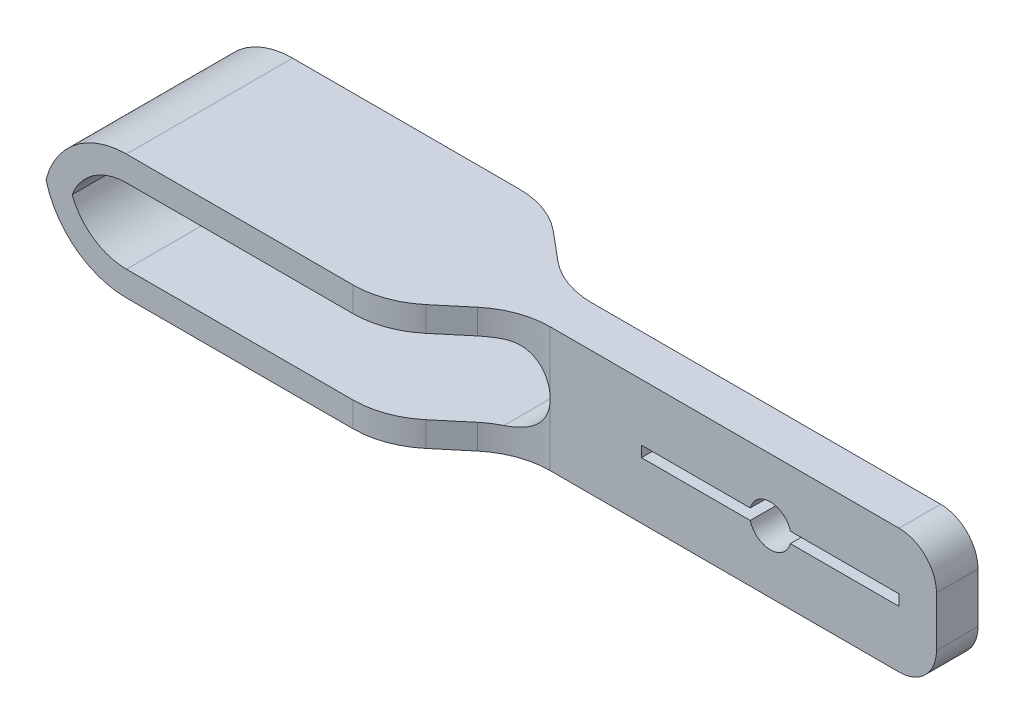
from build123d import *

# Parameters (mm, degrees)
ESBO_O1_W                         = 40
ESBO_O1_H                         = 15
RESSALTO_EXTRUS_O1_DEPTH          = 3
ESBO_O3_W                         = 40
ESBO_O3_H                         = 15
RESSALTO_EXTRUS_O2_DEPTH          = 2
CORTE_EXTRUS_O1_REACH             = 26.418
CORTE_EXTRUS_O1_DIRECTION_2_REACH = 26.418
ESBO_O5_W                         = 20
ESBO_O5_H                         = 15
RESSALTO_EXTRUS_O4_DEPTH          = 60
CHANFRO1_SIZE                     = 19.068057482
CHANFRO1_SIZE_2                   = 16
FILETE4_R                         = 10
CORTE_EXTRUS_O2_DEPTH             = 81.237970309
FILETE5_R                         = 4.5


with BuildPart() as part:
    # Esboço1 → Ressalto-extrusão1 (new body)
    with BuildSketch(Plane.XY):
        with Locations((2.5, 1.5)):
            Rectangle(ESBO_O1_W, ESBO_O1_H)
    extrude(amount=-RESSALTO_EXTRUS_O1_DEPTH)

    # Esboço3 → Ressalto-extrusão2 (add)
    with BuildSketch(Plane.XY):
        with Locations((2.5, 1.5)):
            Rectangle(ESBO_O3_W, ESBO_O3_H)
    extrude(amount=RESSALTO_EXTRUS_O2_DEPTH)

    # Corte-extrusão1: up to this face of the body (flat: up to its plane)
    corte_extrus_o1_end = Plane(part.part.faces().sort_by_distance((2.5, 1.5, 2))[0])
    # Esboço2 → Corte-extrusão1 (cut, up to the picked face)
    with BuildSketch(Plane.XY, mode=Mode.PRIVATE) as corte_extrus_o1_sk1:
        with BuildLine():
            Line((0.085978459, 2.15), (-13, 2.15))
            Line((-13, 2.15), (-13, 0.85))
            Line((-13, 0.85), (0.085978459, 0.85))
            ThreePointArc((0.085978459, 0.85), (2.5, -1), (4.914021541, 0.85))
            Line((4.914021541, 0.85), (18, 0.85))
            Line((18, 0.85), (18, 2.15))
            Line((18, 2.15), (4.914021541, 2.15))
            ThreePointArc((4.914021541, 2.15), (2.5, 4), (0.085978459, 2.15))
        make_face()
    corte_extrus_o1_tool1 = split(extrude(corte_extrus_o1_sk1.sketch, amount=CORTE_EXTRUS_O1_REACH, mode=Mode.PRIVATE), bisect_by=corte_extrus_o1_end, keep=Keep.BOTH, mode=Mode.PRIVATE)
    add(corte_extrus_o1_tool1.solids().sort_by(Axis((2.5, 1.5, 0), (0, 0, 1)))[0], mode=Mode.SUBTRACT)

    # Corte-extrusão1 direction 2: up to this face of the body (flat: up to its plane)
    corte_extrus_o1_direction_2_end = Plane(part.part.faces().sort_by_distance((2.5, 1.5, -3))[0])
    # Esboço2 → Corte-extrusão1 direction 2 (cut, up to the picked face)
    with BuildSketch(Plane.XY, mode=Mode.PRIVATE) as corte_extrus_o1_direction_2_sk1:
        with BuildLine():
            Line((0.085978459, 2.15), (-13, 2.15))
            Line((-13, 2.15), (-13, 0.85))
            Line((-13, 0.85), (0.085978459, 0.85))
            ThreePointArc((0.085978459, 0.85), (2.5, -1), (4.914021541, 0.85))
            Line((4.914021541, 0.85), (18, 0.85))
            Line((18, 0.85), (18, 2.15))
            Line((18, 2.15), (4.914021541, 2.15))
            ThreePointArc((4.914021541, 2.15), (2.5, 4), (0.085978459, 2.15))
        make_face()
    corte_extrus_o1_direction_2_tool1 = split(extrude(corte_extrus_o1_direction_2_sk1.sketch, amount=-CORTE_EXTRUS_O1_DIRECTION_2_REACH, mode=Mode.PRIVATE), bisect_by=corte_extrus_o1_direction_2_end, keep=Keep.BOTH, mode=Mode.PRIVATE)
    add(corte_extrus_o1_direction_2_tool1.solids().sort_by(Axis((2.5, 1.5, 0), (0, 0, -1)))[0], mode=Mode.SUBTRACT)

    # Esboço5 → Ressalto-extrusão4 (add)
    with BuildSketch(Plane.ZY.offset(17.5)):
        with Locations((-0.5, 1.5)):
            Rectangle(ESBO_O5_W, ESBO_O5_H)
    extrude(amount=RESSALTO_EXTRUS_O4_DEPTH)

    # Chanfro1
    # the kernel refuses this chamfer: 19.068057482, 16 mm, written as the material it takes off along each edge
    with BuildSketch(Plane(origin=(-17.5, -55.146127732, 9.5), x_dir=(-0.9996889667359941, 0, 0.024939322090234247), z_dir=(0, 1, 0))) as chanfro1_piece_1_section:
        Polygon((CHANFRO1_SIZE * 0.99968896671, -CHANFRO1_SIZE * 0.0249393220896), (-CHANFRO1_SIZE_2 * 0.0249393220902, -CHANFRO1_SIZE_2 * 0.999688966736), (0, 0), align=None)
    chanfro1_piece_1 = extrude(amount=113.292255464, mode=Mode.PRIVATE)
    chanfro1_piece_1 = split(chanfro1_piece_1, bisect_by=Plane(origin=(-25.155035178, 1.5, 2), z_dir=(0, 0, 1)), keep=Keep.TOP, mode=Mode.PRIVATE)
    add(chanfro1_piece_1, mode=Mode.SUBTRACT)
    with BuildSketch(Plane(origin=(-17.5, -55.146127732, 9.5), x_dir=(-0.9996889667359941, 0, 0.024939322090234247), z_dir=(0, 1, 0))) as chanfro1_piece_2_section:
        Polygon((CHANFRO1_SIZE * 0.99968896671, -CHANFRO1_SIZE * 0.0249393220896), (-CHANFRO1_SIZE_2 * 0.0249393220902, -CHANFRO1_SIZE_2 * 0.999688966736), (0, 0), align=None)
    chanfro1_piece_2 = extrude(amount=113.292255464, mode=Mode.PRIVATE)
    chanfro1_piece_2 = split(chanfro1_piece_2, bisect_by=Plane(origin=(-18.373305927, 1.5, -3), z_dir=(0, 0, -1)), keep=Keep.TOP, mode=Mode.PRIVATE)
    add(chanfro1_piece_2, mode=Mode.SUBTRACT)
    with BuildSketch(Plane(origin=(-17.5, 58.146127732, -10.5), x_dir=(-0.9996889667359941, 0, -0.024939322090234247), z_dir=(0, -1, 0))) as chanfro1_piece_3_section:
        Polygon((CHANFRO1_SIZE * 0.99968896671, -CHANFRO1_SIZE * 0.0249393220896), (-CHANFRO1_SIZE_2 * 0.0249393220902, -CHANFRO1_SIZE_2 * 0.999688966736), (0, 0), align=None)
    chanfro1_piece_3 = extrude(amount=113.292255464, mode=Mode.PRIVATE)
    chanfro1_piece_3 = split(chanfro1_piece_3, bisect_by=Plane(origin=(-25.155035178, 1.5, -3), z_dir=(0, 0, -1)), keep=Keep.TOP, mode=Mode.PRIVATE)
    add(chanfro1_piece_3, mode=Mode.SUBTRACT)
    with BuildSketch(Plane(origin=(-17.5, 58.146127732, -10.5), x_dir=(-0.9996889667359941, 0, -0.024939322090234247), z_dir=(0, -1, 0))) as chanfro1_piece_4_section:
        Polygon((CHANFRO1_SIZE * 0.99968896671, -CHANFRO1_SIZE * 0.0249393220896), (-CHANFRO1_SIZE_2 * 0.0249393220902, -CHANFRO1_SIZE_2 * 0.999688966736), (0, 0), align=None)
    chanfro1_piece_4 = extrude(amount=113.292255464, mode=Mode.PRIVATE)
    chanfro1_piece_4 = split(chanfro1_piece_4, bisect_by=Plane(origin=(-18.373305927, 1.5, 2), z_dir=(0, 0, 1)), keep=Keep.TOP, mode=Mode.PRIVATE)
    add(chanfro1_piece_4, mode=Mode.SUBTRACT)

    # Filete4
    # the kernel refuses this fillet: 10 mm, written as the material it adds along each edge
    with BuildSketch(Plane(origin=(-27.629905537, -6, 2), x_dir=(1, 0, 0), z_dir=(0, 1, 0)), Plane(origin=(-27.629905537, 9, -3), x_dir=(1, 0, 0), z_dir=(0, -1, 0))) as filete4_piece_1:
        with BuildLine():
            CenterArc((FILETE4_R * 0.363970234266, -FILETE4_R), FILETE4_R, 90, 40)
            Line((-FILETE4_R * 0.27881737542, -FILETE4_R * 0.233955556881), (0, 0))
            Line((0, 0), (FILETE4_R * 0.363970234266, 0))
        make_face()
    extrude(amount=15)
    # the kernel refuses this fillet: 10 mm, written as the material it takes off along each edge
    with BuildSketch(Plane(origin=(-36.568057482, -15.099255857, 9.5), x_dir=(-1, 0, 0), z_dir=(0, 1, 0))) as filete4_2_piece_1:
        with BuildLine():
            CenterArc((FILETE4_R * 0.363970234266, -FILETE4_R), FILETE4_R, 90, 40)
            Line((-FILETE4_R * 0.27881737542, -FILETE4_R * 0.233955556881), (0, 0))
            Line((0, 0), (FILETE4_R * 0.363970234266, 0))
        make_face()
    extrude(amount=33.198511713, mode=Mode.SUBTRACT)
    with BuildSketch(Plane(origin=(-77.5, 9, 34.5), x_dir=(0, -1, 0), z_dir=(0, 0, -1))) as filete4_2_piece_2:
        with BuildLine():
            CenterArc((FILETE4_R, -FILETE4_R), FILETE4_R, 90, 90)
            Line((0, -FILETE4_R), (0, 0))
            Line((0, 0), (FILETE4_R, 0))
        make_face()
    extrude(amount=70, mode=Mode.SUBTRACT)
    with BuildSketch(Plane(origin=(-77.5, -6, -35.5), x_dir=(1, 0, 0), z_dir=(0, 0, 1))) as filete4_2_piece_3:
        with BuildLine():
            CenterArc((FILETE4_R, FILETE4_R), FILETE4_R, 180, 90)
            Line((0, FILETE4_R), (0, 0))
            Line((0, 0), (FILETE4_R, 0))
        make_face()
    extrude(amount=70, mode=Mode.SUBTRACT)
    with BuildSketch(Plane(origin=(-36.568057482, 18.099255857, -10.5), x_dir=(0.7660444431190706, 0, 0.6427876096864291), z_dir=(0, -1, 0))) as filete4_2_piece_4:
        with BuildLine():
            CenterArc((FILETE4_R * 0.363970234266, FILETE4_R), FILETE4_R, 230, 40)
            Line((-FILETE4_R * 0.27881737542, FILETE4_R * 0.233955556881), (0, 0))
            Line((0, 0), (FILETE4_R * 0.363970234266, 0))
        make_face()
    extrude(amount=33.198511713, mode=Mode.SUBTRACT)

    # Esboço6 → Corte-extrusão2 (cut, through all)
    with BuildSketch(Plane.XY.offset(9.5)):
        with BuildLine():
            Line((-43.207759824, 6), (-67.5, 6))
            ThreePointArc((-67.5, 6), (-71.468626967, 4.766281297), (-74.038348415, 1.5))
            ThreePointArc((-74.038348415, 1.5), (-71.468626967, -1.766281297), (-67.5, -3))
            Line((-67.5, -3), (-43.207759824, -3))
            Line((-43.207759824, -3), (-23.990203194, -3))
            Line((-23.990203194, -3), (-23.990203194, 6))
            Line((-23.990203194, 6), (-43.207759824, 6))
        make_face()
    extrude(amount=-CORTE_EXTRUS_O2_DEPTH, mode=Mode.SUBTRACT)

    # Filete5
    # the kernel refuses this fillet: 4.5 mm, written as the material it adds along each edge
    with BuildSketch(Plane(origin=(-23.990203194, 6, 13.25), x_dir=(0, -1, 0), z_dir=(0, 0, -1))) as filete5_piece_1_section:
        with BuildLine():
            CenterArc((FILETE5_R, FILETE5_R), FILETE5_R, 180, 90)
            Line((0, FILETE5_R), (0, 0))
            Line((0, 0), (FILETE5_R, 0))
        make_face()
    filete5_piece_1 = extrude(amount=27.5, mode=Mode.PRIVATE)
    filete5_piece_1 = filete5_piece_1 - Plane(origin=(-23.990203194, 5.729138272, 12), x_dir=(1, 0, 0), z_dir=(0, -1, 0)) * Cylinder(10, 73, mode=Mode.PRIVATE)
    filete5_piece_1 = filete5_piece_1 - Plane(origin=(-23.990203194, 5.729138272, -13), x_dir=(1, 0, 0), z_dir=(0, 1, 0)) * Cylinder(10, 73, mode=Mode.PRIVATE)
    add(filete5_piece_1)
    with BuildSketch(Plane(origin=(-23.990203194, -3, 13.25), x_dir=(-1, 0, 0), z_dir=(0, 0, -1))) as filete5_piece_2_section:
        with BuildLine():
            CenterArc((FILETE5_R, FILETE5_R), FILETE5_R, 180, 90)
            Line((0, FILETE5_R), (0, 0))
            Line((0, 0), (FILETE5_R, 0))
        make_face()
    filete5_piece_2 = extrude(amount=27.5, mode=Mode.PRIVATE)
    filete5_piece_2 = filete5_piece_2 - Plane(origin=(-23.990203194, -2.729138204, 12), x_dir=(1, 0, 0), z_dir=(0, -1, 0)) * Cylinder(10, 73, mode=Mode.PRIVATE)
    filete5_piece_2 = filete5_piece_2 - Plane(origin=(-23.990203194, -2.729138204, -13), x_dir=(1, 0, 0), z_dir=(0, 1, 0)) * Cylinder(10, 73, mode=Mode.PRIVATE)
    add(filete5_piece_2)
    # the kernel refuses this fillet: 4.5 mm, written as the material it takes off along each edge
    with BuildSketch(Plane(origin=(22.5, 9, -14.25), x_dir=(0, -1, 0), z_dir=(0, 0, 1))) as filete5_2_piece_1:
        with BuildLine():
            CenterArc((FILETE5_R, -FILETE5_R), FILETE5_R, 90, 90)
            Line((0, -FILETE5_R), (0, 0))
            Line((0, 0), (FILETE5_R, 0))
        make_face()
    extrude(amount=27.5, mode=Mode.SUBTRACT)
    with BuildSketch(Plane(origin=(22.5, -6, -14.25), x_dir=(0, 1, 0), z_dir=(0, 0, 1))) as filete5_2_piece_2:
        with BuildLine():
            CenterArc((FILETE5_R, FILETE5_R), FILETE5_R, 180, 90)
            Line((0, FILETE5_R), (0, 0))
            Line((0, 0), (FILETE5_R, 0))
        make_face()
    extrude(amount=27.5, mode=Mode.SUBTRACT)


solid = part.part
